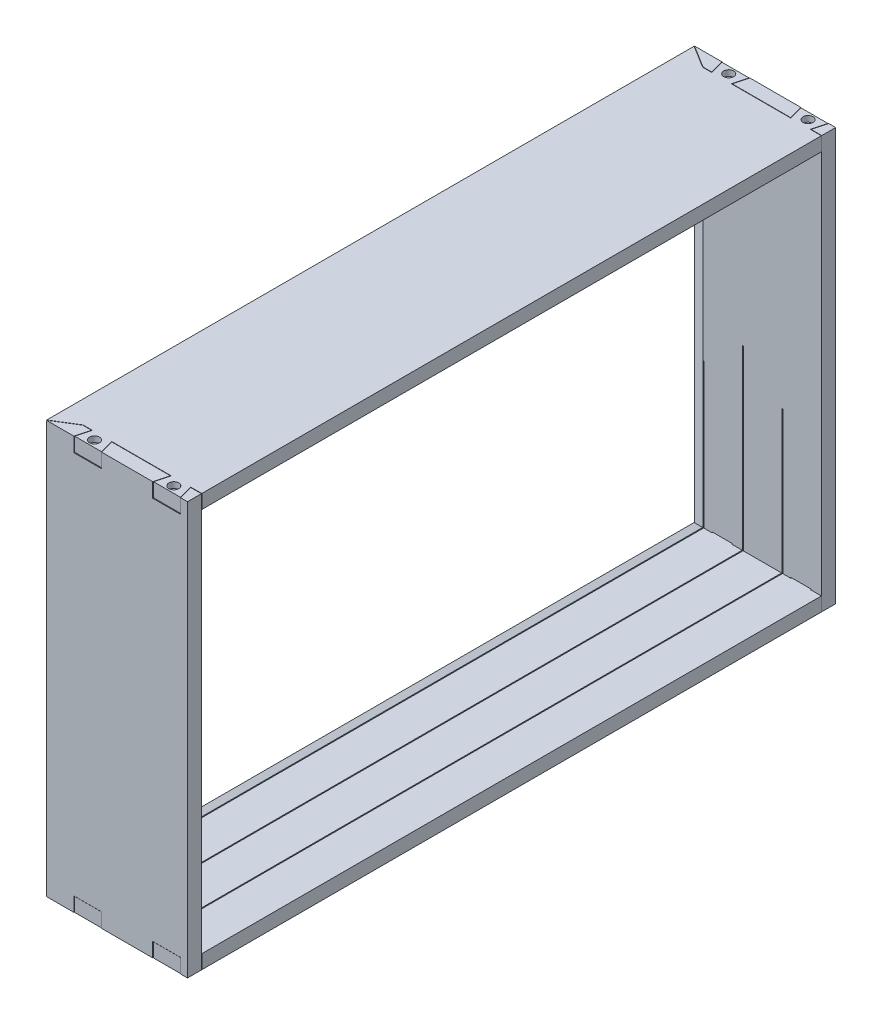
from build123d import *

# Parameters (mm, degrees)
BOSS_EXTRUDE1_DEPTH   = 139.7
BOSS_EXTRUDE1_2_DEPTH = 139.7
BOSS_EXTRUDE2_DEPTH   = 88.9
BOSS_EXTRUDE2_2_DEPTH = 88.9
BOSS_EXTRUDE3_DEPTH   = 6
BOSS_EXTRUDE4_DEPTH   = 6
CUT_EXTRUDE1_DEPTH    = 236.033924413
CUT_EXTRUDE3_DEPTH    = 6.2
SKETCH10_R            = 2.15
CUT_EXTRUDE4_DEPTH    = 2.5
SKETCH10_4_R          = 1.325
CUT_EXTRUDE5_DEPTH    = 236.033924413
SKETCH10_5_R          = 1.175
CUT_EXTRUDE6_DEPTH    = 15
MIRROR3_START         = 73.9
MIRROR3_OUTLINE_R     = 1.175
MIRROR3_DEPTH         = 15
MIRROR3_START_2       = 86.4
MIRROR3_2_OUTLINE_R   = 2.15
MIRROR3_2_OUTLINE_R_2 = 1.175
MIRROR3_2_DEPTH       = 2.5
MIRROR3_START_3       = 82.9
MIRROR3_3_OUTLINE_R   = 1.325
MIRROR3_3_OUTLINE_R_2 = 1.175
MIRROR3_3_DEPTH       = 3.5


# Read off the part's stored shape, not the designer's step: Mirror3
with BuildPart() as part:
    # Sketch1 → Boss-Extrude1 (new, symmetric)
    with BuildSketch(Plane.XY):
        Polygon((3.275, -88.9), (12.975, -82.9), (12.975, -87.9), (13.375, -87.9), (13.375, -82.9), (29.975, -82.9), (29.975, -87.9), (30.375, -87.9), (30.375, -82.9), (46.975, -82.9), (46.975, -87.9), (47.375, -87.9), (47.375, -82.9), (64.125, -82.9), (64.125, -88.9), align=None)
    extrude(amount=BOSS_EXTRUDE1_DEPTH, both=True)


with BuildPart() as body_2:
    # Sketch1 → Boss-Extrude1 2 (new, symmetric)
    with BuildSketch(Plane.XY):
        Polygon((64.125, 88.9), (3.275, 88.9), (12.975, 82.9), (13.375, 82.9), (29.975, 82.9), (30.375, 82.9), (46.975, 82.9), (47.375, 82.9), (64.125, 82.9), align=None)
    extrude(amount=BOSS_EXTRUDE1_2_DEPTH, both=True)


with BuildPart() as body_3:
    # Sketch2 → Boss-Extrude2 (new, symmetric)
    with BuildSketch(Plane(origin=(0, 0, 0), x_dir=(1, 0, 0), z_dir=(0, 1, 0))):
        Polygon((3.275, -139.7), (12.975, -133.7), (12.975, -138.7), (13.375, -138.7), (13.375, -133.7), (29.975, -133.7), (29.975, -138.7), (30.375, -138.7), (30.375, -133.7), (46.975, -133.7), (46.975, -138.7), (47.375, -138.7), (47.375, -133.7), (64.125, -133.7), (64.125, -139.7), align=None)
    extrude(amount=BOSS_EXTRUDE2_DEPTH, both=True)

    # Sketch3 → Boss-Extrude3 (add)
    with BuildSketch(Plane.XY.offset(139.7)):
        Polygon((12.975, 88.9), (12.975, -24.447158706), (29.975, -24.447158706), (29.975, -36.537802732), (30.375, -36.537802732), (46.975, -25.633731009), (47.375, -25.633731009), (64.125, -25.633731009), (64.125, 88.9), align=None)
    extrude(amount=-BOSS_EXTRUDE3_DEPTH)


with BuildPart() as body_4:
    # Sketch2 → Boss-Extrude2 2 (new, symmetric)
    with BuildSketch(Plane(origin=(0, 0, 0), x_dir=(1, 0, 0), z_dir=(0, 1, 0))):
        Polygon((64.125, 139.7), (3.275, 139.7), (12.975, 133.7), (12.975, 138.7), (13.375, 138.7), (13.375, 133.7), (29.975, 133.7), (29.975, 138.7), (30.375, 138.7), (30.375, 133.7), (46.975, 133.7), (46.975, 138.7), (47.375, 138.7), (47.375, 133.7), (64.125, 133.7), align=None)
    extrude(amount=BOSS_EXTRUDE2_2_DEPTH, both=True)

    # Sketch4 → Boss-Extrude4 (add)
    with BuildSketch(Plane(origin=(0, 0, -139.7), x_dir=(-1, 0, 0), z_dir=(0, 0, -1))):
        Polygon((-12.975, 88.9), (-12.975, -20.637158302), (-13.275, -20.637158302), (-22.975, -20.637158302), (-22.975, -6.522989669), (-30.175, -6.522989669), (-40.175, -6.522989669), (-40.175, -21.569874841), (-47.175, -21.569874841), (-64.125, -21.569874841), (-64.125, 88.9), align=None)
    extrude(amount=-BOSS_EXTRUDE4_DEPTH)


with BuildPart() as cut_extrude1_tool:
    # Sketch8 → Cut-Extrude1 (new, through all)
    with BuildSketch(Plane.XZ.offset(88.9)):
        Polygon((64.275, 133.55), (59.321821039, 133.55), (60.929516194, 139.55), (49.320483806, 139.55), (50.928178961, 133.55), (25.321821039, 133.55), (26.929516194, 139.55), (15.320483806, 139.55), (16.928178961, 133.55), (12.932357492, 133.55), (3.125, 139.616406696), (3.125, 144.85), (64.275, 144.85), align=None)
        Polygon((64.275, -144.85), (64.275, -133.55), (59.321821039, -133.55), (60.929516194, -139.55), (49.320483806, -139.55), (50.928178961, -133.55), (25.321821039, -133.55), (26.929516194, -139.55), (15.320483806, -139.55), (16.928178961, -133.55), (12.932357492, -133.55), (3.125, -139.616406696), (3.125, -144.85), align=None)
    extrude(amount=-CUT_EXTRUDE1_DEPTH)


with BuildPart() as part_1:
    add(part.part)

    # Cut-Extrude1: cut by cut_extrude1_tool
    add(cut_extrude1_tool.part, mode=Mode.SUBTRACT)

    # Sketch10 → Cut-Extrude4 (cut)
    with BuildSketch(Plane.XZ.offset(88.9)):
        with Locations(Location((21.030776421, 136.7, 0), (0, 0, 270))):
            Circle(SKETCH10_R)
        with Locations(Location((55.219223579, 136.7, 0), (0, 0, 90))):
            Circle(SKETCH10_R)
        with Locations(Location((55.219223579, -136.7, 0), (0, 0, 270))):
            Circle(SKETCH10_R)
        with Locations(Location((21.030776421, -136.7, 0), (0, 0, 90))):
            Circle(SKETCH10_R)
    extrude(amount=-CUT_EXTRUDE4_DEPTH, mode=Mode.SUBTRACT)

    # Sketch10<4> → Cut-Extrude5 (cut, through all)
    with BuildSketch(Plane.XZ.offset(88.9)):
        with Locations(Location((21.030776421, 136.7, 0), (0, 0, 270))):
            Circle(SKETCH10_4_R)
        with Locations(Location((55.219223579, 136.7, 0), (0, 0, 270))):
            Circle(SKETCH10_4_R)
        with Locations(Location((55.219223579, -136.7, 0), (0, 0, 270))):
            Circle(SKETCH10_4_R)
        with Locations(Location((21.030776421, -136.7, 0), (0, 0, 270))):
            Circle(SKETCH10_4_R)
    extrude(amount=-CUT_EXTRUDE5_DEPTH, mode=Mode.SUBTRACT)


with BuildPart() as body_2_1:
    add(body_2.part)

    # Cut-Extrude1: cut by cut_extrude1_tool
    add(cut_extrude1_tool.part, mode=Mode.SUBTRACT)


with BuildPart() as cut_extrude3_tool:
    # Sketch9 → Cut-Extrude3 (new body)
    with BuildSketch(Plane.XZ.offset(88.9)):
        Polygon((50.732695155, -133.7), (59.517304845, -133.7), (61.125, -139.7), (49.125, -139.7), align=None)
        Polygon((25.517304845, 133.7), (27.125, 139.7), (15.125, 139.7), (16.732695155, 133.7), align=None)
        Polygon((59.517304845, 133.7), (61.125, 139.7), (49.125, 139.7), (50.732695155, 133.7), align=None)
        Polygon((16.732695155, -133.7), (25.517304845, -133.7), (27.125, -139.7), (15.125, -139.7), align=None)
    cut_extrude3 = extrude(amount=-CUT_EXTRUDE3_DEPTH)


with BuildPart() as body_4_1:
    add(body_4.part)

    # Cut-Extrude3: cut by cut_extrude3_tool
    add(cut_extrude3_tool.part, mode=Mode.SUBTRACT)


with BuildPart() as body_3_1:
    add(body_3.part)

    # Cut-Extrude3: cut by cut_extrude3_tool
    add(cut_extrude3_tool.part, mode=Mode.SUBTRACT)


with BuildPart() as mirror2_tool:
    # Mirror2: Cut-Extrude3 across plane
    add(cut_extrude3.mirror(Plane.ZX))


with BuildPart() as body_4_2:
    add(body_4_1.part)

    # Mirror2: cut by mirror2_tool
    add(mirror2_tool.part, mode=Mode.SUBTRACT)


with BuildPart() as body_3_2:
    add(body_3_1.part)

    # Mirror2: cut by mirror2_tool
    add(mirror2_tool.part, mode=Mode.SUBTRACT)


with BuildPart() as cut_extrude6_tool:
    # Sketch10<5> → Cut-Extrude6 (new body)
    with BuildSketch(Plane.XZ.offset(88.9)):
        with Locations(Location((21.030776421, 136.7, 0), (0, 0, 270))):
            Circle(SKETCH10_5_R)
        with Locations(Location((55.219223579, 136.7, 0), (0, 0, 270))):
            Circle(SKETCH10_5_R)
        with Locations(Location((55.219223579, -136.7, 0), (0, 0, 270))):
            Circle(SKETCH10_5_R)
        with Locations(Location((21.030776421, -136.7, 0), (0, 0, 270))):
            Circle(SKETCH10_5_R)
    extrude(amount=-CUT_EXTRUDE6_DEPTH)


with BuildPart() as body_3_3:
    add(body_3_2.part)

    # Cut-Extrude6: cut by cut_extrude6_tool
    add(cut_extrude6_tool.part, mode=Mode.SUBTRACT)


with BuildPart() as body_4_3:
    add(body_4_2.part)

    # Cut-Extrude6: cut by cut_extrude6_tool
    add(cut_extrude6_tool.part, mode=Mode.SUBTRACT)


with BuildPart() as mirror3_tool:
    # Mirror3 outline → Mirror3 (new body)
    with BuildSketch(Plane(origin=(0, 0, 0), x_dir=(1, 0, 0), z_dir=(0, 1, 0)).offset(MIRROR3_START)):
        with Locations((21.030776421, 136.7)):
            Circle(MIRROR3_OUTLINE_R)
        with Locations((55.219223579, 136.7)):
            Circle(MIRROR3_OUTLINE_R)
        with Locations((21.030776421, -136.7)):
            Circle(MIRROR3_OUTLINE_R)
        with Locations((55.219223579, -136.7)):
            Circle(MIRROR3_OUTLINE_R)
    extrude(amount=MIRROR3_DEPTH)


with BuildPart() as body_2_2:
    add(body_2_1.part)

    # Mirror3: cut by mirror3_tool
    add(mirror3_tool.part, mode=Mode.SUBTRACT)

    # Mirror3 2 outline → Mirror3 2 (cut)
    # profile 1 of 4: a face of its own
    with BuildSketch(Plane(origin=(0, 0, 0), x_dir=(1, 0, 0), z_dir=(0, 1, 0)).offset(MIRROR3_START_2)):
        with Locations((21.030776421, -136.7)):
            Circle(MIRROR3_2_OUTLINE_R)
        with Locations((21.030776421, -136.7)):
            Circle(MIRROR3_2_OUTLINE_R_2, mode=Mode.SUBTRACT)
    # profile 2 of 4: a face of its own
    with BuildSketch(Plane(origin=(0, 0, 0), x_dir=(1, 0, 0), z_dir=(0, 1, 0)).offset(MIRROR3_START_2)):
        with Locations((21.030776421, 136.7)):
            Circle(MIRROR3_2_OUTLINE_R)
        with Locations((21.030776421, 136.7)):
            Circle(MIRROR3_2_OUTLINE_R_2, mode=Mode.SUBTRACT)
    # profile 3 of 4: a face of its own
    with BuildSketch(Plane(origin=(0, 0, 0), x_dir=(1, 0, 0), z_dir=(0, 1, 0)).offset(MIRROR3_START_2)):
        with Locations((55.219223579, 136.7)):
            Circle(MIRROR3_2_OUTLINE_R)
        with Locations((55.219223579, 136.7)):
            Circle(MIRROR3_2_OUTLINE_R_2, mode=Mode.SUBTRACT)
    # profile 4 of 4: a face of its own
    with BuildSketch(Plane(origin=(0, 0, 0), x_dir=(1, 0, 0), z_dir=(0, 1, 0)).offset(MIRROR3_START_2)):
        with Locations((55.219223579, -136.7)):
            Circle(MIRROR3_2_OUTLINE_R)
        with Locations((55.219223579, -136.7)):
            Circle(MIRROR3_2_OUTLINE_R_2, mode=Mode.SUBTRACT)
    extrude(amount=MIRROR3_2_DEPTH, mode=Mode.SUBTRACT)

    # Mirror3 3 outline → Mirror3 3 (cut)
    # profile 1 of 4: a face of its own
    with BuildSketch(Plane(origin=(0, 0, 0), x_dir=(1, 0, 0), z_dir=(0, 1, 0)).offset(MIRROR3_START_3)):
        with Locations((21.030776421, 136.7)):
            Circle(MIRROR3_3_OUTLINE_R)
        with Locations((21.030776421, 136.7)):
            Circle(MIRROR3_3_OUTLINE_R_2, mode=Mode.SUBTRACT)
    # profile 2 of 4: a face of its own
    with BuildSketch(Plane(origin=(0, 0, 0), x_dir=(1, 0, 0), z_dir=(0, 1, 0)).offset(MIRROR3_START_3)):
        with Locations((21.030776421, -136.7)):
            Circle(MIRROR3_3_OUTLINE_R)
        with Locations((21.030776421, -136.7)):
            Circle(MIRROR3_3_OUTLINE_R_2, mode=Mode.SUBTRACT)
    # profile 3 of 4: a face of its own
    with BuildSketch(Plane(origin=(0, 0, 0), x_dir=(1, 0, 0), z_dir=(0, 1, 0)).offset(MIRROR3_START_3)):
        with Locations((55.219223579, -136.7)):
            Circle(MIRROR3_3_OUTLINE_R)
        with Locations((55.219223579, -136.7)):
            Circle(MIRROR3_3_OUTLINE_R_2, mode=Mode.SUBTRACT)
    # profile 4 of 4: a face of its own
    with BuildSketch(Plane(origin=(0, 0, 0), x_dir=(1, 0, 0), z_dir=(0, 1, 0)).offset(MIRROR3_START_3)):
        with Locations((55.219223579, 136.7)):
            Circle(MIRROR3_3_OUTLINE_R)
        with Locations((55.219223579, 136.7)):
            Circle(MIRROR3_3_OUTLINE_R_2, mode=Mode.SUBTRACT)
    extrude(amount=MIRROR3_3_DEPTH, mode=Mode.SUBTRACT)


with BuildPart() as body_3_4:
    add(body_3_3.part)

    # Mirror3: cut by mirror3_tool
    add(mirror3_tool.part, mode=Mode.SUBTRACT)


with BuildPart() as body_4_4:
    add(body_4_3.part)

    # Mirror3: cut by mirror3_tool
    add(mirror3_tool.part, mode=Mode.SUBTRACT)


solid = Compound([part_1.part, body_2_2.part, body_3_4.part, body_4_4.part])
